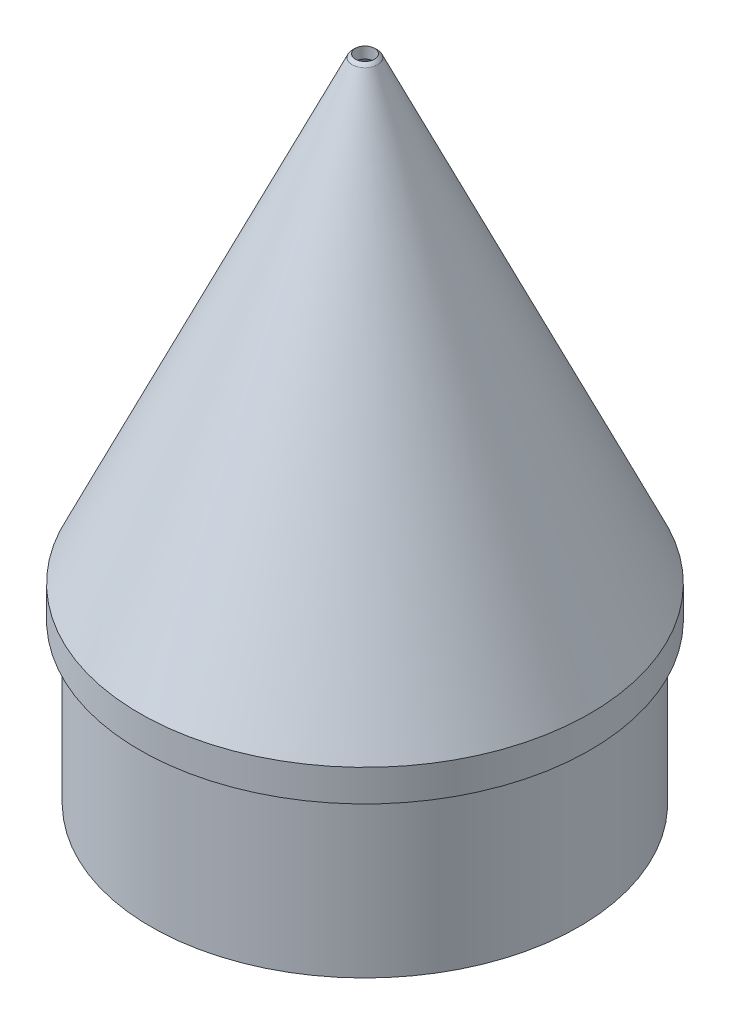
from build123d import *

# Parameters (mm, degrees)
SHELL1_T            = -2
SKETCH7_R           = 3
CUT_EXTRUDE3_DEPTH  = 186.253539274
BOSS_EXTRUDE1_DEPTH = 7.5
CUT_EXTRUDE4_DEPTH  = 1.75
CIRPATTERN1_COUNT   = 2


with BuildPart() as part:
    # Sketch3 → Revolve1 (revolve)
    with BuildSketch(Plane.XY):
        with BuildLine():
            Line((0, 0), (0, 155.681963674))
            ThreePointArc((0, 155.681963674), (2.236067977, 155.154099629), (4, 153.681963674))
            Line((4, 153.681963674), (71, 10))
            Line((71, 10), (71, 0))
            Line((71, 0), (67.5, 0))
            Line((67.5, 0), (67.5, -50))
            Line((67.5, -50), (0, -50))
            Line((0, -50), (0, 0))
        make_face()
    revolve(axis=Axis((0, 0, 0), (0, 1, 0)))

    # Shell1
    shell1_openings = [part.faces().sort_by_distance(p)[0] for p in [
        (0, -50, 0),
    ]]
    offset(amount=SHELL1_T, openings=shell1_openings, kind=Kind.INTERSECTION)

    # Sketch7 → Cut-Extrude3 (cut, through all)
    with BuildSketch(Plane(origin=(0, 0, 0), x_dir=(1, 0, 0), z_dir=(0, 1, 0))):
        Circle(SKETCH7_R)
    extrude(amount=CUT_EXTRUDE3_DEPTH, mode=Mode.SUBTRACT)

    # Sketch8 → Boss-Extrude1 (add, symmetric)
    with BuildSketch(Plane(origin=(0, 0, 0), x_dir=(0, 0, -1), z_dir=(1, 0, 0))):
        Polygon((-39.806982196, 40.909925586), (-39.806982196, 35.909925586), (-44.806982196, 34.090074414), (-57.559857977, 34.090074414), (-44.806982196, 61.438704783), (-44.806982196, 44.090074414), (-44.806982196, 39.090074414), align=None)
    boss_extrude1 = extrude(amount=BOSS_EXTRUDE1_DEPTH, both=True)

    # Sketch9 → Cut-Extrude4 (cut, symmetric)
    with BuildSketch(Plane(origin=(0, 0, 0), x_dir=(0, 0, -1), z_dir=(1, 0, 0))):
        Polygon((-44.806982196, 39.090074414), (-44.806982196, 60.101912939), (-57.113307932, 26.985013938), (-44.806982196, 34.090074414), (-39.806982196, 35.909925586), (-39.806982196, 40.909925586), align=None)
    cut_extrude4 = extrude(amount=CUT_EXTRUDE4_DEPTH, both=True, mode=Mode.SUBTRACT)

    # CirPattern1: Boss-Extrude1, Cut-Extrude4 ×2 about axis
    cirpattern1_axis = Axis((0, 0, 0), (0, -1, 0))
    add([boss_extrude1.rotate(cirpattern1_axis, i * 360 / CIRPATTERN1_COUNT) for i in range(1, CIRPATTERN1_COUNT)])
    add([cut_extrude4.rotate(cirpattern1_axis, i * 360 / CIRPATTERN1_COUNT) for i in range(1, CIRPATTERN1_COUNT)], mode=Mode.SUBTRACT)


solid = part.part
